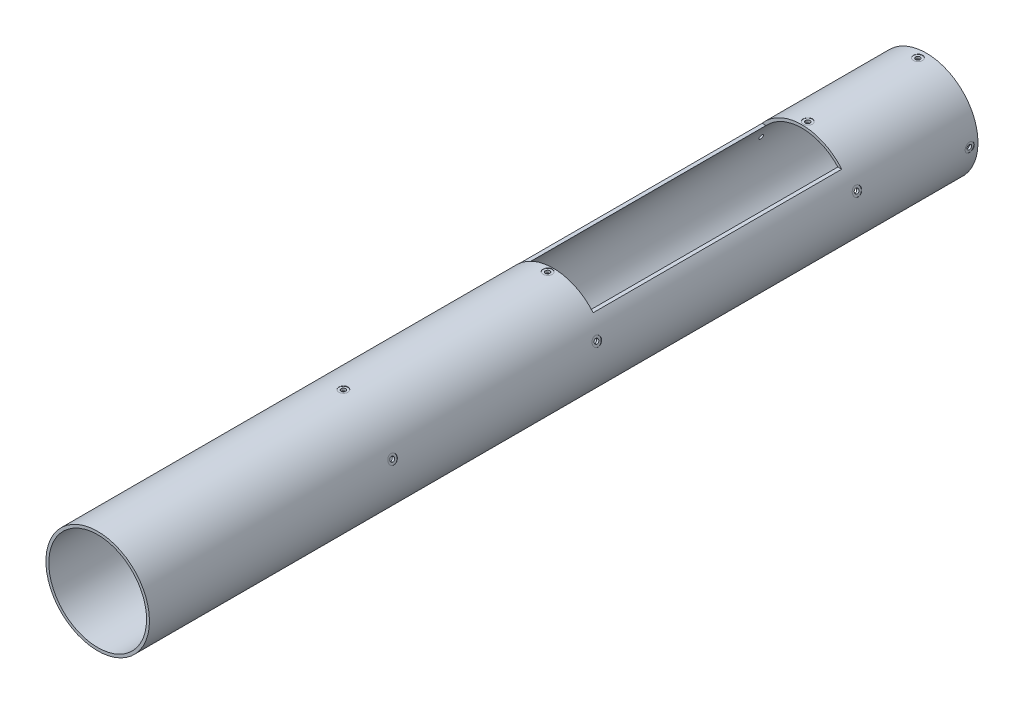
from build123d import *

# Parameters (mm, degrees)
SKETCH1_R                                          = 62.5
SKETCH1_R_2                                        = 59
BOSS_EXTRUDE1_DEPTH                                = 1000
CUT_EXTRUDE4_REACH                                 = 1009.18
SKETCH4_W                                          = 125
SKETCH4_H                                          = 300
CBORE_FOR_M5_PAN_HEAD_SCREW1_D                     = 5.5
CBORE_FOR_M5_PAN_HEAD_SCREW1_DEPTH                 = 3
CBORE_FOR_M5_PAN_HEAD_SCREW1_CBORE_D               = 11
CBORE_FOR_M5_PAN_HEAD_SCREW1_CBORE_DEPTH           = 0.5
CBORE_FOR_M5_PAN_HEAD_SCREW1_TIP                   = 1.652366702
CBORE_FOR_M5_PAN_HEAD_SCREW1_ON_FACE_2_D           = 5.5
CBORE_FOR_M5_PAN_HEAD_SCREW1_ON_FACE_2_DEPTH       = 3
CBORE_FOR_M5_PAN_HEAD_SCREW1_ON_FACE_2_CBORE_D     = 11
CBORE_FOR_M5_PAN_HEAD_SCREW1_ON_FACE_2_CBORE_DEPTH = 0.5
CBORE_FOR_M5_PAN_HEAD_SCREW1_ON_FACE_2_TIP         = 1.652366702
CBORE_FOR_M5_PAN_HEAD_SCREW1_ON_FACE_3_D           = 5.5
CBORE_FOR_M5_PAN_HEAD_SCREW1_ON_FACE_3_DEPTH       = 3
CBORE_FOR_M5_PAN_HEAD_SCREW1_ON_FACE_3_CBORE_D     = 11
CBORE_FOR_M5_PAN_HEAD_SCREW1_ON_FACE_3_CBORE_DEPTH = 0.5
CBORE_FOR_M5_PAN_HEAD_SCREW1_ON_FACE_3_TIP         = 1.652366702
CBORE_FOR_M5_PAN_HEAD_SCREW1_ON_FACE_4_D           = 5.5
CBORE_FOR_M5_PAN_HEAD_SCREW1_ON_FACE_4_DEPTH       = 3
CBORE_FOR_M5_PAN_HEAD_SCREW1_ON_FACE_4_CBORE_D     = 11
CBORE_FOR_M5_PAN_HEAD_SCREW1_ON_FACE_4_CBORE_DEPTH = 0.5
CBORE_FOR_M5_PAN_HEAD_SCREW1_ON_FACE_4_TIP         = 1.652366702
CBORE_START                                        = 58.935876117
CBORE_FOR_M5_PAN_HEAD_SCREW2_OUTLINE_R             = 2.75
CBORE_FOR_M5_PAN_HEAD_SCREW2_DEPTH                 = 3.564123983
CBORE_START_2                                      = 62
CBORE_FOR_M5_PAN_HEAD_SCREW2_2_OUTLINE_R           = 5.5
CBORE_FOR_M5_PAN_HEAD_SCREW2_2_OUTLINE_R_2         = 2.75
CBORE_FOR_M5_PAN_HEAD_SCREW2_2_DEPTH               = 0.5000001
CBORE_START_3                                      = 58.93587607
CBORE_FOR_M5_PAN_HEAD_SCREW2_3_OUTLINE_R           = 2.75
CBORE_FOR_M5_PAN_HEAD_SCREW2_3_DEPTH               = 3.56412367
CBORE_FOR_M5_PAN_HEAD_SCREW2_4_OUTLINE_R           = 5.5
CBORE_FOR_M5_PAN_HEAD_SCREW2_4_OUTLINE_R_2         = 2.75
CBORE_FOR_M5_PAN_HEAD_SCREW2_4_DEPTH               = 0.49999974
CBORE_FOR_M5_PAN_HEAD_SCREW2_5_OUTLINE_R           = 2.75
CBORE_FOR_M5_PAN_HEAD_SCREW2_5_DEPTH               = 3.56412367
CBORE_FOR_M5_PAN_HEAD_SCREW2_6_OUTLINE_R           = 5.5
CBORE_FOR_M5_PAN_HEAD_SCREW2_6_OUTLINE_R_2         = 2.75
CBORE_FOR_M5_PAN_HEAD_SCREW2_6_DEPTH               = 0.49999974
CBORE_START_4                                      = -62.49999974
CBORE_FOR_M5_PAN_HEAD_SCREW2_7_OUTLINE_R           = 2.75
CBORE_FOR_M5_PAN_HEAD_SCREW2_7_DEPTH               = 3.56412367
CBORE_FOR_M5_PAN_HEAD_SCREW2_8_OUTLINE_R           = 5.5
CBORE_FOR_M5_PAN_HEAD_SCREW2_8_OUTLINE_R_2         = 2.75
CBORE_FOR_M5_PAN_HEAD_SCREW2_8_DEPTH               = 0.49999974
CBORE_FOR_M5_PAN_HEAD_SCREW2_9_OUTLINE_R           = 2.75
CBORE_FOR_M5_PAN_HEAD_SCREW2_9_DEPTH               = 3.56412367
CBORE_FOR_M5_PAN_HEAD_SCREW2_10_OUTLINE_R          = 5.5
CBORE_FOR_M5_PAN_HEAD_SCREW2_10_OUTLINE_R_2        = 2.75
CBORE_FOR_M5_PAN_HEAD_SCREW2_10_DEPTH              = 0.49999974
CUT_EXTRUDE8_START                                 = -127
CUT_EXTRUDE8_DEPTH                                 = 112
CBORE_FOR_M5_PAN_HEAD_SCREW3_OUTLINE_R             = 2.75
CBORE_FOR_M5_PAN_HEAD_SCREW3_DEPTH                 = 3.564123983
CBORE_FOR_M5_PAN_HEAD_SCREW3_2_OUTLINE_R           = 5.5
CBORE_FOR_M5_PAN_HEAD_SCREW3_2_OUTLINE_R_2         = 2.75
CBORE_FOR_M5_PAN_HEAD_SCREW3_2_DEPTH               = 0.5000001
CBORE_FOR_M5_PAN_HEAD_SCREW3_3_OUTLINE_R           = 2.75
CBORE_FOR_M5_PAN_HEAD_SCREW3_3_DEPTH               = 3.56412367
CBORE_FOR_M5_PAN_HEAD_SCREW3_4_OUTLINE_R           = 5.5
CBORE_FOR_M5_PAN_HEAD_SCREW3_4_OUTLINE_R_2         = 2.75
CBORE_FOR_M5_PAN_HEAD_SCREW3_4_DEPTH               = 0.49999974
CBORE_FOR_M5_PAN_HEAD_SCREW3_5_OUTLINE_R           = 2.75
CBORE_FOR_M5_PAN_HEAD_SCREW3_5_DEPTH               = 3.56412367
CBORE_FOR_M5_PAN_HEAD_SCREW3_6_OUTLINE_R           = 5.5
CBORE_FOR_M5_PAN_HEAD_SCREW3_6_OUTLINE_R_2         = 2.75
CBORE_FOR_M5_PAN_HEAD_SCREW3_6_DEPTH               = 0.49999974
CBORE_FOR_M5_PAN_HEAD_SCREW3_7_OUTLINE_R           = 2.75
CBORE_FOR_M5_PAN_HEAD_SCREW3_7_DEPTH               = 3.56412367
CBORE_FOR_M5_PAN_HEAD_SCREW3_8_OUTLINE_R           = 5.5
CBORE_FOR_M5_PAN_HEAD_SCREW3_8_OUTLINE_R_2         = 2.75
CBORE_FOR_M5_PAN_HEAD_SCREW3_8_DEPTH               = 0.49999974
CBORE_FOR_M5_PAN_HEAD_SCREW3_9_OUTLINE_R           = 2.75
CBORE_FOR_M5_PAN_HEAD_SCREW3_9_DEPTH               = 3.56412367
CBORE_FOR_M5_PAN_HEAD_SCREW3_10_OUTLINE_R          = 5.5
CBORE_FOR_M5_PAN_HEAD_SCREW3_10_OUTLINE_R_2        = 2.75
CBORE_FOR_M5_PAN_HEAD_SCREW3_10_DEPTH              = 0.49999974


# Read off the part's stored shape, not the designer's step: CBORE for M5 Pan Head Screw2, CBORE for M5 Pan Head Screw3
with BuildPart() as part:
    # Sketch1 → Boss-Extrude1 (new body)
    with BuildSketch(Plane.XY):
        Circle(SKETCH1_R)
        Circle(SKETCH1_R_2, mode=Mode.SUBTRACT)
    extrude(amount=BOSS_EXTRUDE1_DEPTH)

    # Sketch4 → Cut-Extrude4 (cut, up to next)
    with BuildSketch(Plane(origin=(0, 40, 0), x_dir=(1, 0, 0), z_dir=(0, 1, 0)), mode=Mode.PRIVATE) as cut_extrude4_sk1:
        with Locations((0, -300)):
            Rectangle(SKETCH4_W, SKETCH4_H)
    cut_extrude4_tool1 = extrude(cut_extrude4_sk1.sketch, amount=CUT_EXTRUDE4_REACH, mode=Mode.PRIVATE) & part.part
    add(cut_extrude4_tool1.solids().sort_by_distance((0, 40, 300))[0], mode=Mode.SUBTRACT)

    # CBORE for M5 Pan Head Screw1
    with Locations(Plane(origin=(0, 62.5, 10), x_dir=(1, 0, 0), z_dir=(0, 1, 0))):
        with Locations((0, 0)):
            CounterBoreHole(CBORE_FOR_M5_PAN_HEAD_SCREW1_D / 2, CBORE_FOR_M5_PAN_HEAD_SCREW1_CBORE_D / 2, CBORE_FOR_M5_PAN_HEAD_SCREW1_CBORE_DEPTH, depth=CBORE_FOR_M5_PAN_HEAD_SCREW1_DEPTH)
            with Locations((0, 0, -(CBORE_FOR_M5_PAN_HEAD_SCREW1_DEPTH + CBORE_FOR_M5_PAN_HEAD_SCREW1_TIP / 2))):  # 118° drill point
                Cone(0, CBORE_FOR_M5_PAN_HEAD_SCREW1_D / 2, CBORE_FOR_M5_PAN_HEAD_SCREW1_TIP, mode=Mode.SUBTRACT)

    # CBORE for M5 Pan Head Screw1 on face 2
    with Locations(Plane(origin=(62.5, 0, 10), x_dir=(0, 0, 1), z_dir=(1, 0, 0))):
        with Locations((0, 0)):
            CounterBoreHole(CBORE_FOR_M5_PAN_HEAD_SCREW1_ON_FACE_2_D / 2, CBORE_FOR_M5_PAN_HEAD_SCREW1_ON_FACE_2_CBORE_D / 2, CBORE_FOR_M5_PAN_HEAD_SCREW1_ON_FACE_2_CBORE_DEPTH, depth=CBORE_FOR_M5_PAN_HEAD_SCREW1_ON_FACE_2_DEPTH)
            with Locations((0, 0, -(CBORE_FOR_M5_PAN_HEAD_SCREW1_ON_FACE_2_DEPTH + CBORE_FOR_M5_PAN_HEAD_SCREW1_ON_FACE_2_TIP / 2))):  # 118° drill point
                Cone(0, CBORE_FOR_M5_PAN_HEAD_SCREW1_ON_FACE_2_D / 2, CBORE_FOR_M5_PAN_HEAD_SCREW1_ON_FACE_2_TIP, mode=Mode.SUBTRACT)

    # CBORE for M5 Pan Head Screw1 on face 3
    with Locations(Plane(origin=(0, -62.5, 10), x_dir=(0, 0, -1), z_dir=(0, -1, 0))):
        with Locations((0, 0)):
            CounterBoreHole(CBORE_FOR_M5_PAN_HEAD_SCREW1_ON_FACE_3_D / 2, CBORE_FOR_M5_PAN_HEAD_SCREW1_ON_FACE_3_CBORE_D / 2, CBORE_FOR_M5_PAN_HEAD_SCREW1_ON_FACE_3_CBORE_DEPTH, depth=CBORE_FOR_M5_PAN_HEAD_SCREW1_ON_FACE_3_DEPTH)
            with Locations((0, 0, -(CBORE_FOR_M5_PAN_HEAD_SCREW1_ON_FACE_3_DEPTH + CBORE_FOR_M5_PAN_HEAD_SCREW1_ON_FACE_3_TIP / 2))):  # 118° drill point
                Cone(0, CBORE_FOR_M5_PAN_HEAD_SCREW1_ON_FACE_3_D / 2, CBORE_FOR_M5_PAN_HEAD_SCREW1_ON_FACE_3_TIP, mode=Mode.SUBTRACT)

    # CBORE for M5 Pan Head Screw1 on face 4
    with Locations(Plane(origin=(-62.5, 0, 10), x_dir=(0, 0, -1), z_dir=(-1, 0, 0))):
        with Locations((0, 0)):
            CounterBoreHole(CBORE_FOR_M5_PAN_HEAD_SCREW1_ON_FACE_4_D / 2, CBORE_FOR_M5_PAN_HEAD_SCREW1_ON_FACE_4_CBORE_D / 2, CBORE_FOR_M5_PAN_HEAD_SCREW1_ON_FACE_4_CBORE_DEPTH, depth=CBORE_FOR_M5_PAN_HEAD_SCREW1_ON_FACE_4_DEPTH)
            with Locations((0, 0, -(CBORE_FOR_M5_PAN_HEAD_SCREW1_ON_FACE_4_DEPTH + CBORE_FOR_M5_PAN_HEAD_SCREW1_ON_FACE_4_TIP / 2))):  # 118° drill point
                Cone(0, CBORE_FOR_M5_PAN_HEAD_SCREW1_ON_FACE_4_D / 2, CBORE_FOR_M5_PAN_HEAD_SCREW1_ON_FACE_4_TIP, mode=Mode.SUBTRACT)

    # CBORE for M5 Pan Head Screw2 outline → CBORE for M5 Pan Head Screw2 (cut)
    with BuildSketch(Plane(origin=(0, 0, 0), x_dir=(1, 0, 0), z_dir=(0, 1, 0)).offset(CBORE_START)):
        with Locations((0, -703.5)):
            Circle(CBORE_FOR_M5_PAN_HEAD_SCREW2_OUTLINE_R)
    extrude(amount=CBORE_FOR_M5_PAN_HEAD_SCREW2_DEPTH, mode=Mode.SUBTRACT)

    # CBORE for M5 Pan Head Screw2 2 outline → CBORE for M5 Pan Head Screw2 2 (cut)
    with BuildSketch(Plane(origin=(0, 0, 0), x_dir=(1, 0, 0), z_dir=(0, 1, 0)).offset(CBORE_START_2)):
        with Locations((0, -703.5)):
            Circle(CBORE_FOR_M5_PAN_HEAD_SCREW2_2_OUTLINE_R)
        with Locations((0, -703.5)):
            Circle(CBORE_FOR_M5_PAN_HEAD_SCREW2_2_OUTLINE_R_2, mode=Mode.SUBTRACT)
    extrude(amount=CBORE_FOR_M5_PAN_HEAD_SCREW2_2_DEPTH, mode=Mode.SUBTRACT)

    # CBORE for M5 Pan Head Screw2 3 outline → CBORE for M5 Pan Head Screw2 3 (cut)
    with BuildSketch(Plane(origin=(0, 0, 0), x_dir=(-0.30901699437494795, 0.9510565162951534, 0), z_dir=(0.9510565162951535, 0.3090169943749479, 0)).offset(CBORE_START_3)):
        with Locations((0, 703.5)):
            Circle(CBORE_FOR_M5_PAN_HEAD_SCREW2_3_OUTLINE_R)
    extrude(amount=CBORE_FOR_M5_PAN_HEAD_SCREW2_3_DEPTH, mode=Mode.SUBTRACT)

    # CBORE for M5 Pan Head Screw2 4 outline → CBORE for M5 Pan Head Screw2 4 (cut)
    with BuildSketch(Plane(origin=(0, 0, 0), x_dir=(-0.30901699437494795, 0.9510565162951534, 0), z_dir=(0.9510565162951535, 0.3090169943749479, 0)).offset(CBORE_START_2)):
        with Locations((0, 703.5)):
            Circle(CBORE_FOR_M5_PAN_HEAD_SCREW2_4_OUTLINE_R)
        with Locations((0, 703.5)):
            Circle(CBORE_FOR_M5_PAN_HEAD_SCREW2_4_OUTLINE_R_2, mode=Mode.SUBTRACT)
    extrude(amount=CBORE_FOR_M5_PAN_HEAD_SCREW2_4_DEPTH, mode=Mode.SUBTRACT)

    # CBORE for M5 Pan Head Screw2 5 outline → CBORE for M5 Pan Head Screw2 5 (cut)
    with BuildSketch(Plane(origin=(0, 0, 0), x_dir=(0.8090169943749472, 0.5877852522924732, 0), z_dir=(0.5877852522924732, -0.8090169943749473, 0)).offset(CBORE_START_3)):
        with Locations((0, 703.5)):
            Circle(CBORE_FOR_M5_PAN_HEAD_SCREW2_5_OUTLINE_R)
    extrude(amount=CBORE_FOR_M5_PAN_HEAD_SCREW2_5_DEPTH, mode=Mode.SUBTRACT)

    # CBORE for M5 Pan Head Screw2 6 outline → CBORE for M5 Pan Head Screw2 6 (cut)
    with BuildSketch(Plane(origin=(0, 0, 0), x_dir=(0.8090169943749472, 0.5877852522924732, 0), z_dir=(0.5877852522924732, -0.8090169943749473, 0)).offset(CBORE_START_2)):
        with Locations((0, 703.5)):
            Circle(CBORE_FOR_M5_PAN_HEAD_SCREW2_6_OUTLINE_R)
        with Locations((0, 703.5)):
            Circle(CBORE_FOR_M5_PAN_HEAD_SCREW2_6_OUTLINE_R_2, mode=Mode.SUBTRACT)
    extrude(amount=CBORE_FOR_M5_PAN_HEAD_SCREW2_6_DEPTH, mode=Mode.SUBTRACT)

    # CBORE for M5 Pan Head Screw2 7 outline → CBORE for M5 Pan Head Screw2 7 (cut)
    with BuildSketch(Plane(origin=(0, 0, 0), x_dir=(0.8090169943749472, -0.5877852522924732, 0), z_dir=(0.5877852522924732, 0.8090169943749473, 0)).offset(CBORE_START_4)):
        with Locations((0, -703.5)):
            Circle(CBORE_FOR_M5_PAN_HEAD_SCREW2_7_OUTLINE_R)
    extrude(amount=CBORE_FOR_M5_PAN_HEAD_SCREW2_7_DEPTH, mode=Mode.SUBTRACT)

    # CBORE for M5 Pan Head Screw2 8 outline → CBORE for M5 Pan Head Screw2 8 (cut)
    with BuildSketch(Plane(origin=(0, 0, 0), x_dir=(0.8090169943749472, -0.5877852522924732, 0), z_dir=(0.5877852522924732, 0.8090169943749473, 0)).offset(CBORE_START_4)):
        with Locations((0, -703.5)):
            Circle(CBORE_FOR_M5_PAN_HEAD_SCREW2_8_OUTLINE_R)
        with Locations((0, -703.5)):
            Circle(CBORE_FOR_M5_PAN_HEAD_SCREW2_8_OUTLINE_R_2, mode=Mode.SUBTRACT)
    extrude(amount=CBORE_FOR_M5_PAN_HEAD_SCREW2_8_DEPTH, mode=Mode.SUBTRACT)

    # CBORE for M5 Pan Head Screw2 9 outline → CBORE for M5 Pan Head Screw2 9 (cut)
    with BuildSketch(Plane(origin=(0, 0, 0), x_dir=(0.309016994374947, 0.9510565162951538, 0), z_dir=(0.9510565162951538, -0.30901699437494695, 0)).offset(CBORE_START_4)):
        with Locations((0, 703.5)):
            Circle(CBORE_FOR_M5_PAN_HEAD_SCREW2_9_OUTLINE_R)
    extrude(amount=CBORE_FOR_M5_PAN_HEAD_SCREW2_9_DEPTH, mode=Mode.SUBTRACT)

    # CBORE for M5 Pan Head Screw2 10 outline → CBORE for M5 Pan Head Screw2 10 (cut)
    with BuildSketch(Plane(origin=(0, 0, 0), x_dir=(0.309016994374947, 0.9510565162951538, 0), z_dir=(0.9510565162951538, -0.30901699437494695, 0)).offset(CBORE_START_4)):
        with Locations((0, 703.5)):
            Circle(CBORE_FOR_M5_PAN_HEAD_SCREW2_10_OUTLINE_R)
        with Locations((0, 703.5)):
            Circle(CBORE_FOR_M5_PAN_HEAD_SCREW2_10_OUTLINE_R_2, mode=Mode.SUBTRACT)
    extrude(amount=CBORE_FOR_M5_PAN_HEAD_SCREW2_10_DEPTH, mode=Mode.SUBTRACT)

    # Sketch9 → Cut-Extrude8 (cut)
    with BuildSketch(Plane.XY.offset(150).offset(CUT_EXTRUDE8_START)):
        with BuildLine():
            Line((0, 0), (-35.848527272, -51.197002768))
            ThreePointArc((-35.848527272, -51.197002768), (0, -62.5), (35.848527272, -51.197002768))
            Line((35.848527272, -51.197002768), (0, 0))
        make_face()
    extrude(amount=CUT_EXTRUDE8_DEPTH, mode=Mode.SUBTRACT)

    # CBORE for M5 Pan Head Screw3 outline → CBORE for M5 Pan Head Screw3 (cut)
    with BuildSketch(Plane(origin=(0, 0, 0), x_dir=(1, 0, 0), z_dir=(0, 1, 0)).offset(CBORE_START)):
        with Locations((0, -457)):
            Circle(CBORE_FOR_M5_PAN_HEAD_SCREW3_OUTLINE_R)
        with Locations((0, -143)):
            Circle(CBORE_FOR_M5_PAN_HEAD_SCREW3_OUTLINE_R)
    extrude(amount=CBORE_FOR_M5_PAN_HEAD_SCREW3_DEPTH, mode=Mode.SUBTRACT)

    # CBORE for M5 Pan Head Screw3 2 outline → CBORE for M5 Pan Head Screw3 2 (cut)
    # profile 1 of 2: a face of its own
    with BuildSketch(Plane(origin=(0, 0, 0), x_dir=(1, 0, 0), z_dir=(0, 1, 0)).offset(CBORE_START_2)):
        with Locations((0, -457)):
            Circle(CBORE_FOR_M5_PAN_HEAD_SCREW3_2_OUTLINE_R)
        with Locations((0, -457)):
            Circle(CBORE_FOR_M5_PAN_HEAD_SCREW3_2_OUTLINE_R_2, mode=Mode.SUBTRACT)
    # profile 2 of 2: a face of its own
    with BuildSketch(Plane(origin=(0, 0, 0), x_dir=(1, 0, 0), z_dir=(0, 1, 0)).offset(CBORE_START_2)):
        with Locations((0, -143)):
            Circle(CBORE_FOR_M5_PAN_HEAD_SCREW3_2_OUTLINE_R)
        with Locations((0, -143)):
            Circle(CBORE_FOR_M5_PAN_HEAD_SCREW3_2_OUTLINE_R_2, mode=Mode.SUBTRACT)
    extrude(amount=CBORE_FOR_M5_PAN_HEAD_SCREW3_2_DEPTH, mode=Mode.SUBTRACT)

    # CBORE for M5 Pan Head Screw3 3 outline → CBORE for M5 Pan Head Screw3 3 (cut)
    with BuildSketch(Plane(origin=(0, 0, 0), x_dir=(-0.30901699437494795, 0.9510565162951534, 0), z_dir=(0.9510565162951535, 0.3090169943749479, 0)).offset(CBORE_START_3)):
        with Locations((0, 457)):
            Circle(CBORE_FOR_M5_PAN_HEAD_SCREW3_3_OUTLINE_R)
        with Locations((0, 143)):
            Circle(CBORE_FOR_M5_PAN_HEAD_SCREW3_3_OUTLINE_R)
    extrude(amount=CBORE_FOR_M5_PAN_HEAD_SCREW3_3_DEPTH, mode=Mode.SUBTRACT)

    # CBORE for M5 Pan Head Screw3 4 outline → CBORE for M5 Pan Head Screw3 4 (cut)
    # profile 1 of 2: a face of its own
    with BuildSketch(Plane(origin=(0, 0, 0), x_dir=(-0.30901699437494795, 0.9510565162951534, 0), z_dir=(0.9510565162951535, 0.3090169943749479, 0)).offset(CBORE_START_2)):
        with Locations((0, 457)):
            Circle(CBORE_FOR_M5_PAN_HEAD_SCREW3_4_OUTLINE_R)
        with Locations((0, 457)):
            Circle(CBORE_FOR_M5_PAN_HEAD_SCREW3_4_OUTLINE_R_2, mode=Mode.SUBTRACT)
    # profile 2 of 2: a face of its own
    with BuildSketch(Plane(origin=(0, 0, 0), x_dir=(-0.30901699437494795, 0.9510565162951534, 0), z_dir=(0.9510565162951535, 0.3090169943749479, 0)).offset(CBORE_START_2)):
        with Locations((0, 143)):
            Circle(CBORE_FOR_M5_PAN_HEAD_SCREW3_4_OUTLINE_R)
        with Locations((0, 143)):
            Circle(CBORE_FOR_M5_PAN_HEAD_SCREW3_4_OUTLINE_R_2, mode=Mode.SUBTRACT)
    extrude(amount=CBORE_FOR_M5_PAN_HEAD_SCREW3_4_DEPTH, mode=Mode.SUBTRACT)

    # CBORE for M5 Pan Head Screw3 5 outline → CBORE for M5 Pan Head Screw3 5 (cut)
    with BuildSketch(Plane(origin=(0, 0, 0), x_dir=(0.8090169943749472, 0.5877852522924732, 0), z_dir=(0.5877852522924732, -0.8090169943749473, 0)).offset(CBORE_START_3)):
        with Locations((0, 457)):
            Circle(CBORE_FOR_M5_PAN_HEAD_SCREW3_5_OUTLINE_R)
        with Locations((0, 143)):
            Circle(CBORE_FOR_M5_PAN_HEAD_SCREW3_5_OUTLINE_R)
    extrude(amount=CBORE_FOR_M5_PAN_HEAD_SCREW3_5_DEPTH, mode=Mode.SUBTRACT)

    # CBORE for M5 Pan Head Screw3 6 outline → CBORE for M5 Pan Head Screw3 6 (cut)
    # profile 1 of 2: a face of its own
    with BuildSketch(Plane(origin=(0, 0, 0), x_dir=(0.8090169943749472, 0.5877852522924732, 0), z_dir=(0.5877852522924732, -0.8090169943749473, 0)).offset(CBORE_START_2)):
        with Locations((0, 457)):
            Circle(CBORE_FOR_M5_PAN_HEAD_SCREW3_6_OUTLINE_R)
        with Locations((0, 457)):
            Circle(CBORE_FOR_M5_PAN_HEAD_SCREW3_6_OUTLINE_R_2, mode=Mode.SUBTRACT)
    # profile 2 of 2: a face of its own
    with BuildSketch(Plane(origin=(0, 0, 0), x_dir=(0.8090169943749472, 0.5877852522924732, 0), z_dir=(0.5877852522924732, -0.8090169943749473, 0)).offset(CBORE_START_2)):
        with Locations((0, 143)):
            Circle(CBORE_FOR_M5_PAN_HEAD_SCREW3_6_OUTLINE_R)
        with Locations((0, 143)):
            Circle(CBORE_FOR_M5_PAN_HEAD_SCREW3_6_OUTLINE_R_2, mode=Mode.SUBTRACT)
    extrude(amount=CBORE_FOR_M5_PAN_HEAD_SCREW3_6_DEPTH, mode=Mode.SUBTRACT)

    # CBORE for M5 Pan Head Screw3 7 outline → CBORE for M5 Pan Head Screw3 7 (cut)
    with BuildSketch(Plane(origin=(0, 0, 0), x_dir=(0.8090169943749472, -0.5877852522924732, 0), z_dir=(0.5877852522924732, 0.8090169943749473, 0)).offset(CBORE_START_4)):
        with Locations((0, -457)):
            Circle(CBORE_FOR_M5_PAN_HEAD_SCREW3_7_OUTLINE_R)
        with Locations((0, -143)):
            Circle(CBORE_FOR_M5_PAN_HEAD_SCREW3_7_OUTLINE_R)
    extrude(amount=CBORE_FOR_M5_PAN_HEAD_SCREW3_7_DEPTH, mode=Mode.SUBTRACT)

    # CBORE for M5 Pan Head Screw3 8 outline → CBORE for M5 Pan Head Screw3 8 (cut)
    # profile 1 of 2: a face of its own
    with BuildSketch(Plane(origin=(0, 0, 0), x_dir=(0.8090169943749472, -0.5877852522924732, 0), z_dir=(0.5877852522924732, 0.8090169943749473, 0)).offset(CBORE_START_4)):
        with Locations((0, -457)):
            Circle(CBORE_FOR_M5_PAN_HEAD_SCREW3_8_OUTLINE_R)
        with Locations((0, -457)):
            Circle(CBORE_FOR_M5_PAN_HEAD_SCREW3_8_OUTLINE_R_2, mode=Mode.SUBTRACT)
    # profile 2 of 2: a face of its own
    with BuildSketch(Plane(origin=(0, 0, 0), x_dir=(0.8090169943749472, -0.5877852522924732, 0), z_dir=(0.5877852522924732, 0.8090169943749473, 0)).offset(CBORE_START_4)):
        with Locations((0, -143)):
            Circle(CBORE_FOR_M5_PAN_HEAD_SCREW3_8_OUTLINE_R)
        with Locations((0, -143)):
            Circle(CBORE_FOR_M5_PAN_HEAD_SCREW3_8_OUTLINE_R_2, mode=Mode.SUBTRACT)
    extrude(amount=CBORE_FOR_M5_PAN_HEAD_SCREW3_8_DEPTH, mode=Mode.SUBTRACT)

    # CBORE for M5 Pan Head Screw3 9 outline → CBORE for M5 Pan Head Screw3 9 (cut)
    with BuildSketch(Plane(origin=(0, 0, 0), x_dir=(0.3090169943749482, 0.9510565162951534, 0), z_dir=(0.9510565162951534, -0.3090169943749481, 0)).offset(CBORE_START_4)):
        with Locations((0, 457)):
            Circle(CBORE_FOR_M5_PAN_HEAD_SCREW3_9_OUTLINE_R)
        with Locations((0, 143)):
            Circle(CBORE_FOR_M5_PAN_HEAD_SCREW3_9_OUTLINE_R)
    extrude(amount=CBORE_FOR_M5_PAN_HEAD_SCREW3_9_DEPTH, mode=Mode.SUBTRACT)

    # CBORE for M5 Pan Head Screw3 10 outline → CBORE for M5 Pan Head Screw3 10 (cut)
    # profile 1 of 2: a face of its own
    with BuildSketch(Plane(origin=(0, 0, 0), x_dir=(0.3090169943749482, 0.9510565162951534, 0), z_dir=(0.9510565162951534, -0.3090169943749481, 0)).offset(CBORE_START_4)):
        with Locations((0, 457)):
            Circle(CBORE_FOR_M5_PAN_HEAD_SCREW3_10_OUTLINE_R)
        with Locations((0, 457)):
            Circle(CBORE_FOR_M5_PAN_HEAD_SCREW3_10_OUTLINE_R_2, mode=Mode.SUBTRACT)
    # profile 2 of 2: a face of its own
    with BuildSketch(Plane(origin=(0, 0, 0), x_dir=(0.3090169943749482, 0.9510565162951534, 0), z_dir=(0.9510565162951534, -0.3090169943749481, 0)).offset(CBORE_START_4)):
        with Locations((0, 143)):
            Circle(CBORE_FOR_M5_PAN_HEAD_SCREW3_10_OUTLINE_R)
        with Locations((0, 143)):
            Circle(CBORE_FOR_M5_PAN_HEAD_SCREW3_10_OUTLINE_R_2, mode=Mode.SUBTRACT)
    extrude(amount=CBORE_FOR_M5_PAN_HEAD_SCREW3_10_DEPTH, mode=Mode.SUBTRACT)


solid = part.part
